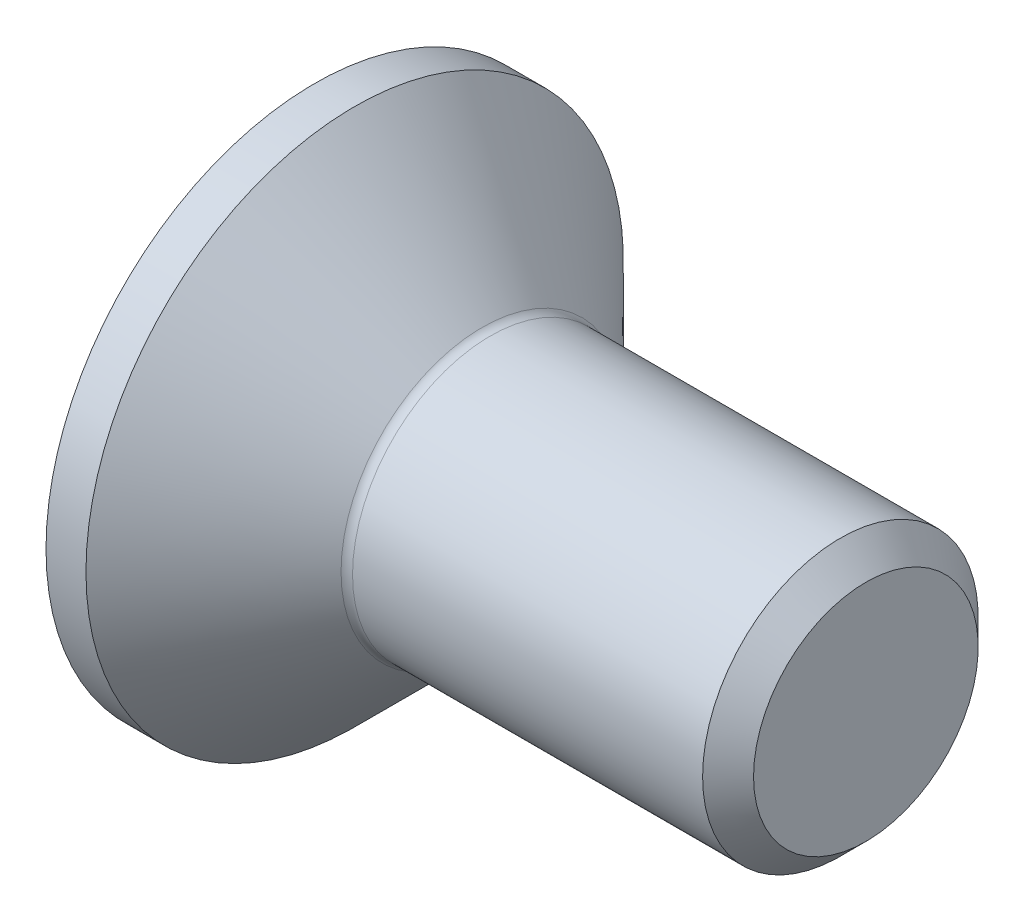
from build123d import *

# Parameters (mm, degrees)
FILLET1_R   = 0.25
HEX_START   = -2.2
HEX_2_DEPTH = 2.2


with BuildPart() as part:
    # BodySke → BaseBody (revolve)
    with BuildSketch(Plane.XY, mode=Mode.PRIVATE) as basebody_sk:
        Polygon((0, 0), (0, 5.85), (0.87, 5.85), (3.72, 3), (11.4455, 3), (12, 2.4455), (12, 0), align=None)
    revolve(basebody_sk.sketch.rotate(Axis((0, 0, 0), (1, 0, 0)), 90), axis=Axis((0, 0, 0), (1, 0, 0)))

    # Fillet1
    fillet1_edges = [part.edges().sort_by_distance(p)[0] for p in [
        (3.72, 0, -3),
    ]]
    fillet(fillet1_edges, radius=FILLET1_R)

    # Hex 2: read off the stored shape, not the designer's step
    # Hex 2 outline → Hex 2 (cut)
    with BuildSketch(Plane.ZY.offset(HEX_START)):
        Polygon((-2, -1.154700538), (0, -2.309401077), (2, -1.154700538), (2, 1.154700538), (0, 2.309401077), (-2, 1.154700538), align=None)
    extrude(amount=HEX_2_DEPTH, mode=Mode.SUBTRACT)

    # Hex 2 2 outline → Hex 2 2 (revolve, cut)
    with BuildSketch(Plane.YX):
        Polygon((2, 2.2), (0, 3.354700538), (0, 2.2), align=None)
    revolve(axis=Axis((0, 0, 0), (1, 0, 0)), mode=Mode.SUBTRACT)


solid = part.part
